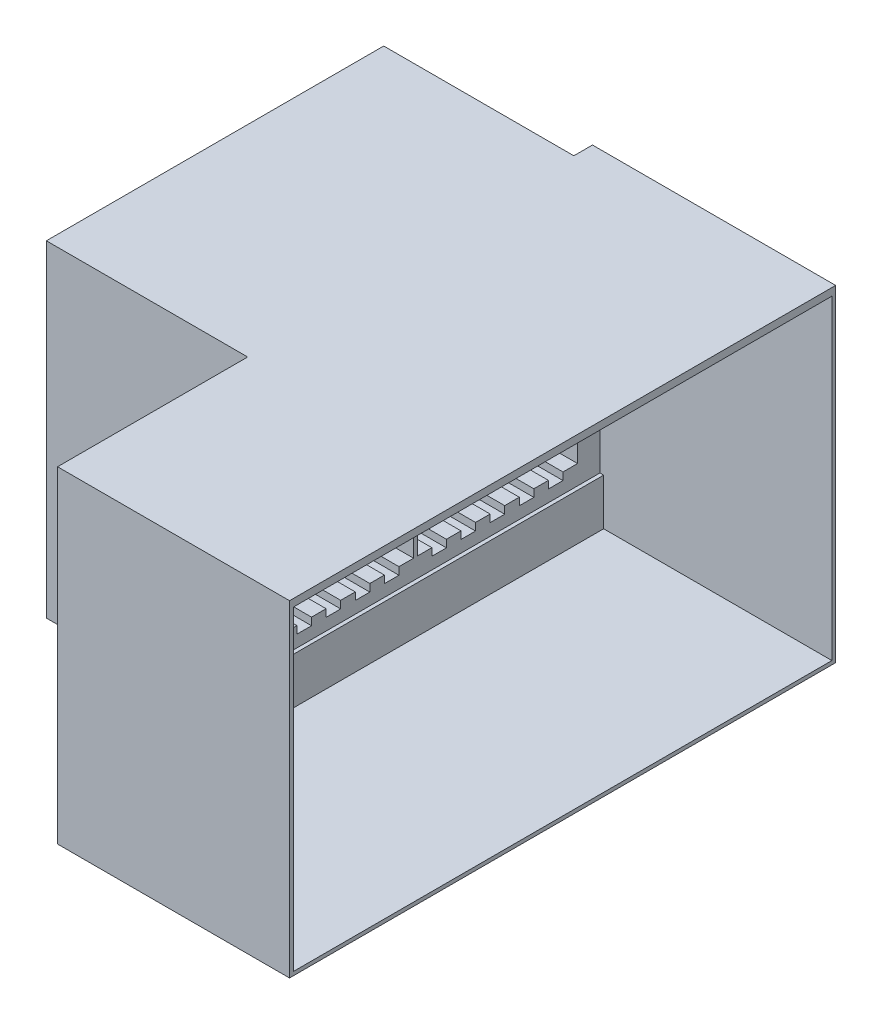
from build123d import *

# Parameters (mm, degrees)
SKETCH_3380_W                        = 955
SKETCH_3380_H                        = 876.56
EXTRUDE_3558_DEPTH                   = 1162.3
SKETCH_3599_W                        = 945
SKETCH_3599_H                        = 721.96
CUT_EXTRUDE_3658_DEPTH               = 622.3
SKETCH_3708_W                        = 430
SKETCH_3708_H                        = 320
CUT_EXTRUDE_3800_DEPTH               = 510
SKETCH_3851_W                        = 435
SKETCH_3851_H                        = 320
CUT_EXTRUDE_3944_DEPTH               = 10
SKETCH_3993_W                        = 602.3
SKETCH_3993_H                        = 945
CUT_EXTRUDE_4521_DEPTH               = 124.6
SKETCH_4570_W                        = 602.3
SKETCH_4570_H                        = 945
CUT_EXTRUDE_4710_DEPTH               = 10
SKETCH_4765_W                        = 39.090909091
SKETCH_4765_H                        = 20
CUT_EXTRUDE_4919_DEPTH               = 510
PATTERN_LINEAR_4973_COUNT            = 5
PATTERN_LINEAR_4973_PITCH            = 78.181818182
PATTERN_LINEAR_5041_COUNT            = 2
PATTERN_LINEAR_5041_PITCH            = 440
PATTERN_LINEAR_5041_COUNT_DIR2       = 2
PATTERN_LINEAR_5041_PITCH_DIR2       = 350
PATTERN_LINEAR_5041_COPY_1_SKETCH_W  = 39.090909091
PATTERN_LINEAR_5041_COPY_1_SKETCH_H  = 20
PATTERN_LINEAR_5041_COPY_1_DEPTH     = 510
PATTERN_LINEAR_5041_COPY_2_SKETCH_W  = 39.090909091
PATTERN_LINEAR_5041_COPY_2_SKETCH_H  = 20
PATTERN_LINEAR_5041_COPY_2_DEPTH     = 510
PATTERN_LINEAR_5041_COPY_3_SKETCH_W  = 39.090909091
PATTERN_LINEAR_5041_COPY_3_SKETCH_H  = 20
PATTERN_LINEAR_5041_COPY_3_DEPTH     = 510
PATTERN_LINEAR_5041_COPY_4_SKETCH_W  = 39.090909091
PATTERN_LINEAR_5041_COPY_4_SKETCH_H  = 20
PATTERN_LINEAR_5041_COPY_4_DEPTH     = 510
PATTERN_LINEAR_5041_COPY_5_SKETCH_W  = 39.090909091
PATTERN_LINEAR_5041_COPY_5_SKETCH_H  = 20
PATTERN_LINEAR_5041_COPY_5_DEPTH     = 510
PATTERN_LINEAR_5041_COPY_6_SKETCH_W  = 39.090909091
PATTERN_LINEAR_5041_COPY_6_SKETCH_H  = 20
PATTERN_LINEAR_5041_COPY_6_DEPTH     = 510
PATTERN_LINEAR_5041_COPY_7_SKETCH_W  = 39.090909091
PATTERN_LINEAR_5041_COPY_7_SKETCH_H  = 20
PATTERN_LINEAR_5041_COPY_7_DEPTH     = 510
PATTERN_LINEAR_5041_COPY_8_SKETCH_W  = 39.090909091
PATTERN_LINEAR_5041_COPY_8_SKETCH_H  = 20
PATTERN_LINEAR_5041_COPY_8_DEPTH     = 510
PATTERN_LINEAR_5041_COPY_9_SKETCH_W  = 39.090909091
PATTERN_LINEAR_5041_COPY_9_SKETCH_H  = 20
PATTERN_LINEAR_5041_COPY_9_DEPTH     = 510
PATTERN_LINEAR_5041_COPY_10_SKETCH_W = 39.090909091
PATTERN_LINEAR_5041_COPY_10_SKETCH_H = 20
PATTERN_LINEAR_5041_COPY_10_DEPTH    = 510
PATTERN_LINEAR_5041_COPY_11_SKETCH_W = 39.090909091
PATTERN_LINEAR_5041_COPY_11_SKETCH_H = 20
PATTERN_LINEAR_5041_COPY_11_DEPTH    = 510
PATTERN_LINEAR_5041_COPY_12_SKETCH_W = 39.090909091
PATTERN_LINEAR_5041_COPY_12_SKETCH_H = 20
PATTERN_LINEAR_5041_COPY_12_DEPTH    = 510
PATTERN_LINEAR_5041_COPY_13_SKETCH_W = 39.090909091
PATTERN_LINEAR_5041_COPY_13_SKETCH_H = 20
PATTERN_LINEAR_5041_COPY_13_DEPTH    = 510
PATTERN_LINEAR_5041_COPY_14_SKETCH_W = 39.090909091
PATTERN_LINEAR_5041_COPY_14_SKETCH_H = 20
PATTERN_LINEAR_5041_COPY_14_DEPTH    = 510
PATTERN_LINEAR_5041_COPY_15_SKETCH_W = 39.090909091
PATTERN_LINEAR_5041_COPY_15_SKETCH_H = 20
PATTERN_LINEAR_5041_COPY_15_DEPTH    = 510
EXTRUDE_5710_DEPTH                   = 500
SKETCH_5791_W                        = 622.3
SKETCH_5791_H                        = 876.56
EXTRUDE_5950_DEPTH                   = 10
SKETCH_14_W                          = 510
SKETCH_14_H                          = 876.56
CUT_EXTRUDE_1_DEPTH                  = 50
CUT_EXTRUDE_2_REACH                  = 1588.88
SKETCH_15_W                          = 1445
SKETCH_15_H                          = 124.6


with BuildPart() as part:
    # Sketch 3380 → Extrude 3558 (new body)
    with BuildSketch(Plane(origin=(0, 0, 0), x_dir=(0, 0, -1), z_dir=(1, 0, 0))):
        Rectangle(SKETCH_3380_W, SKETCH_3380_H)
    extrude(amount=EXTRUDE_3558_DEPTH)

    # Sketch 3599 → Cut-Extrude 3658 (cut)
    with BuildSketch(Plane(origin=(1162.3, 0, 0), x_dir=(0, 0, -1), z_dir=(1, 0, 0))):
        with Locations((-5, 57.3)):
            Rectangle(SKETCH_3599_W, SKETCH_3599_H)
    extrude(amount=-CUT_EXTRUDE_3658_DEPTH, mode=Mode.SUBTRACT)

    # Sketch 3708 → Cut-Extrude 3800 (cut)
    with BuildSketch(Plane(origin=(540, 0, 0), x_dir=(0, 0, -1), z_dir=(1, 0, 0))):
        with Locations((-247.5, 258.28)):
            Rectangle(SKETCH_3708_W, SKETCH_3708_H)
    cut_extrude_3800 = extrude(amount=-CUT_EXTRUDE_3800_DEPTH, mode=Mode.SUBTRACT)

    # Sketch 3851 → Cut-Extrude 3944 (cut)
    with BuildSketch(Plane.ZY):
        with Locations((250, 258.28)):
            Rectangle(SKETCH_3851_W, SKETCH_3851_H)
    cut_extrude_3944 = extrude(amount=-CUT_EXTRUDE_3944_DEPTH, mode=Mode.SUBTRACT)

    # Sketch 3993 → Cut-Extrude 4521 (cut)
    with BuildSketch(Plane(origin=(0, -303.68, 0), x_dir=(1, 0, 0), z_dir=(0, 1, 0))):
        with Locations((851.15, -5)):
            Rectangle(SKETCH_3993_W, SKETCH_3993_H)
    extrude(amount=-CUT_EXTRUDE_4521_DEPTH, mode=Mode.SUBTRACT)

    # Sketch 4570 → Cut-Extrude 4710 (cut)
    with BuildSketch(Plane.XZ.offset(-418.28)):
        with Locations((851.15, 5)):
            Rectangle(SKETCH_4570_W, SKETCH_4570_H)
    extrude(amount=-CUT_EXTRUDE_4710_DEPTH, mode=Mode.SUBTRACT)

    # Sketch 4765 → Cut-Extrude 4919 (cut)
    with BuildSketch(Plane(origin=(540, 0, 0), x_dir=(0, 0, -1), z_dir=(1, 0, 0))):
        with Locations((-403.863636364, 88.28)):
            Rectangle(SKETCH_4765_W, SKETCH_4765_H)
    cut_extrude_4919 = extrude(amount=-CUT_EXTRUDE_4919_DEPTH, mode=Mode.SUBTRACT)

    # Pattern Linear 4973: Cut-Extrude 4919 ×5
    with Locations(*[(0, 0, -i * PATTERN_LINEAR_4973_PITCH) for i in range(1, PATTERN_LINEAR_4973_COUNT)]):
        add(cut_extrude_4919, mode=Mode.SUBTRACT)

    # Pattern Linear 5041: Cut-Extrude 3800, Cut-Extrude 3944 2 × 2
    with Locations(*[(0, -j * PATTERN_LINEAR_5041_PITCH_DIR2, -i * PATTERN_LINEAR_5041_PITCH) for i in range(PATTERN_LINEAR_5041_COUNT) for j in range(PATTERN_LINEAR_5041_COUNT_DIR2) if (i, j) != (0, 0)]):
        add(cut_extrude_3800, mode=Mode.SUBTRACT)
        add(cut_extrude_3944, mode=Mode.SUBTRACT)

    # Pattern Linear 5041 copy 1 sketch → Pattern Linear 5041 copy 1 (cut)
    with BuildSketch(Plane(origin=(540, -350, -78.181818182), x_dir=(0, 0, -1), z_dir=(1, 0, 0))):
        with Locations((-403.863636364, 88.28)):
            Rectangle(PATTERN_LINEAR_5041_COPY_1_SKETCH_W, PATTERN_LINEAR_5041_COPY_1_SKETCH_H)
    extrude(amount=-PATTERN_LINEAR_5041_COPY_1_DEPTH, mode=Mode.SUBTRACT)

    # Pattern Linear 5041 copy 2 sketch → Pattern Linear 5041 copy 2 (cut)
    with BuildSketch(Plane(origin=(540, 0, -518.181818182), x_dir=(0, 0, -1), z_dir=(1, 0, 0))):
        with Locations((-403.863636364, 88.28)):
            Rectangle(PATTERN_LINEAR_5041_COPY_2_SKETCH_W, PATTERN_LINEAR_5041_COPY_2_SKETCH_H)
    extrude(amount=-PATTERN_LINEAR_5041_COPY_2_DEPTH, mode=Mode.SUBTRACT)

    # Pattern Linear 5041 copy 3 sketch → Pattern Linear 5041 copy 3 (cut)
    with BuildSketch(Plane(origin=(540, -350, -518.181818182), x_dir=(0, 0, -1), z_dir=(1, 0, 0))):
        with Locations((-403.863636364, 88.28)):
            Rectangle(PATTERN_LINEAR_5041_COPY_3_SKETCH_W, PATTERN_LINEAR_5041_COPY_3_SKETCH_H)
    extrude(amount=-PATTERN_LINEAR_5041_COPY_3_DEPTH, mode=Mode.SUBTRACT)

    # Pattern Linear 5041 copy 4 sketch → Pattern Linear 5041 copy 4 (cut)
    with BuildSketch(Plane(origin=(540, -350, -156.363636364), x_dir=(0, 0, -1), z_dir=(1, 0, 0))):
        with Locations((-403.863636364, 88.28)):
            Rectangle(PATTERN_LINEAR_5041_COPY_4_SKETCH_W, PATTERN_LINEAR_5041_COPY_4_SKETCH_H)
    extrude(amount=-PATTERN_LINEAR_5041_COPY_4_DEPTH, mode=Mode.SUBTRACT)

    # Pattern Linear 5041 copy 5 sketch → Pattern Linear 5041 copy 5 (cut)
    with BuildSketch(Plane(origin=(540, 0, -596.363636364), x_dir=(0, 0, -1), z_dir=(1, 0, 0))):
        with Locations((-403.863636364, 88.28)):
            Rectangle(PATTERN_LINEAR_5041_COPY_5_SKETCH_W, PATTERN_LINEAR_5041_COPY_5_SKETCH_H)
    extrude(amount=-PATTERN_LINEAR_5041_COPY_5_DEPTH, mode=Mode.SUBTRACT)

    # Pattern Linear 5041 copy 6 sketch → Pattern Linear 5041 copy 6 (cut)
    with BuildSketch(Plane(origin=(540, -350, -596.363636364), x_dir=(0, 0, -1), z_dir=(1, 0, 0))):
        with Locations((-403.863636364, 88.28)):
            Rectangle(PATTERN_LINEAR_5041_COPY_6_SKETCH_W, PATTERN_LINEAR_5041_COPY_6_SKETCH_H)
    extrude(amount=-PATTERN_LINEAR_5041_COPY_6_DEPTH, mode=Mode.SUBTRACT)

    # Pattern Linear 5041 copy 7 sketch → Pattern Linear 5041 copy 7 (cut)
    with BuildSketch(Plane(origin=(540, -350, -234.545454545), x_dir=(0, 0, -1), z_dir=(1, 0, 0))):
        with Locations((-403.863636364, 88.28)):
            Rectangle(PATTERN_LINEAR_5041_COPY_7_SKETCH_W, PATTERN_LINEAR_5041_COPY_7_SKETCH_H)
    extrude(amount=-PATTERN_LINEAR_5041_COPY_7_DEPTH, mode=Mode.SUBTRACT)

    # Pattern Linear 5041 copy 8 sketch → Pattern Linear 5041 copy 8 (cut)
    with BuildSketch(Plane(origin=(540, 0, -674.545454545), x_dir=(0, 0, -1), z_dir=(1, 0, 0))):
        with Locations((-403.863636364, 88.28)):
            Rectangle(PATTERN_LINEAR_5041_COPY_8_SKETCH_W, PATTERN_LINEAR_5041_COPY_8_SKETCH_H)
    extrude(amount=-PATTERN_LINEAR_5041_COPY_8_DEPTH, mode=Mode.SUBTRACT)

    # Pattern Linear 5041 copy 9 sketch → Pattern Linear 5041 copy 9 (cut)
    with BuildSketch(Plane(origin=(540, -350, -674.545454545), x_dir=(0, 0, -1), z_dir=(1, 0, 0))):
        with Locations((-403.863636364, 88.28)):
            Rectangle(PATTERN_LINEAR_5041_COPY_9_SKETCH_W, PATTERN_LINEAR_5041_COPY_9_SKETCH_H)
    extrude(amount=-PATTERN_LINEAR_5041_COPY_9_DEPTH, mode=Mode.SUBTRACT)

    # Pattern Linear 5041 copy 10 sketch → Pattern Linear 5041 copy 10 (cut)
    with BuildSketch(Plane(origin=(540, -350, -312.727272727), x_dir=(0, 0, -1), z_dir=(1, 0, 0))):
        with Locations((-403.863636364, 88.28)):
            Rectangle(PATTERN_LINEAR_5041_COPY_10_SKETCH_W, PATTERN_LINEAR_5041_COPY_10_SKETCH_H)
    extrude(amount=-PATTERN_LINEAR_5041_COPY_10_DEPTH, mode=Mode.SUBTRACT)

    # Pattern Linear 5041 copy 11 sketch → Pattern Linear 5041 copy 11 (cut)
    with BuildSketch(Plane(origin=(540, 0, -752.727272727), x_dir=(0, 0, -1), z_dir=(1, 0, 0))):
        with Locations((-403.863636364, 88.28)):
            Rectangle(PATTERN_LINEAR_5041_COPY_11_SKETCH_W, PATTERN_LINEAR_5041_COPY_11_SKETCH_H)
    extrude(amount=-PATTERN_LINEAR_5041_COPY_11_DEPTH, mode=Mode.SUBTRACT)

    # Pattern Linear 5041 copy 12 sketch → Pattern Linear 5041 copy 12 (cut)
    with BuildSketch(Plane(origin=(540, -350, -752.727272727), x_dir=(0, 0, -1), z_dir=(1, 0, 0))):
        with Locations((-403.863636364, 88.28)):
            Rectangle(PATTERN_LINEAR_5041_COPY_12_SKETCH_W, PATTERN_LINEAR_5041_COPY_12_SKETCH_H)
    extrude(amount=-PATTERN_LINEAR_5041_COPY_12_DEPTH, mode=Mode.SUBTRACT)

    # Pattern Linear 5041 copy 13 sketch → Pattern Linear 5041 copy 13 (cut)
    with BuildSketch(Plane(origin=(540, -350, 0), x_dir=(0, 0, -1), z_dir=(1, 0, 0))):
        with Locations((-403.863636364, 88.28)):
            Rectangle(PATTERN_LINEAR_5041_COPY_13_SKETCH_W, PATTERN_LINEAR_5041_COPY_13_SKETCH_H)
    extrude(amount=-PATTERN_LINEAR_5041_COPY_13_DEPTH, mode=Mode.SUBTRACT)

    # Pattern Linear 5041 copy 14 sketch → Pattern Linear 5041 copy 14 (cut)
    with BuildSketch(Plane(origin=(540, 0, -440), x_dir=(0, 0, -1), z_dir=(1, 0, 0))):
        with Locations((-403.863636364, 88.28)):
            Rectangle(PATTERN_LINEAR_5041_COPY_14_SKETCH_W, PATTERN_LINEAR_5041_COPY_14_SKETCH_H)
    extrude(amount=-PATTERN_LINEAR_5041_COPY_14_DEPTH, mode=Mode.SUBTRACT)

    # Pattern Linear 5041 copy 15 sketch → Pattern Linear 5041 copy 15 (cut)
    with BuildSketch(Plane(origin=(540, -350, -440), x_dir=(0, 0, -1), z_dir=(1, 0, 0))):
        with Locations((-403.863636364, 88.28)):
            Rectangle(PATTERN_LINEAR_5041_COPY_15_SKETCH_W, PATTERN_LINEAR_5041_COPY_15_SKETCH_H)
    extrude(amount=-PATTERN_LINEAR_5041_COPY_15_DEPTH, mode=Mode.SUBTRACT)

    # Sketch 5113 → Extrude 5710 (add)
    with BuildSketch(Plane.XY.offset(477.5)):
        Polygon((1162.3, -438.28), (1162.3, -303.68), (1152.3, -303.68), (1152.3, -428.28), (550, -428.28), (550, -303.68), (540, -303.68), (540, -438.28), align=None)
        Polygon((1152.3, 418.28), (1162.3, 418.28), (1162.3, 438.28), (540, 438.28), (540, 418.28), (550, 418.28), (550, 428.28), (1152.3, 428.28), align=None)
    extrude(amount=EXTRUDE_5710_DEPTH)

    # Sketch 5791 → Extrude 5950 (add)
    with BuildSketch(Plane.XY.offset(977.5)):
        with Locations((851.15, 0)):
            Rectangle(SKETCH_5791_W, SKETCH_5791_H)
    extrude(amount=EXTRUDE_5950_DEPTH)

    # Эскиз14 → Вырез-Вытянуть1 (cut)
    with BuildSketch(Plane(origin=(0, 0, -477.5), x_dir=(-1, 0, 0), z_dir=(0, 0, -1))):
        with Locations((-255, 0)):
            Rectangle(SKETCH_14_W, SKETCH_14_H)
    extrude(amount=-CUT_EXTRUDE_1_DEPTH, mode=Mode.SUBTRACT)

    # Эскиз15 → Вырез-Вытянуть2 (cut, up to next)
    with BuildSketch(Plane(origin=(1162.3, 0, 0), x_dir=(0, 0, -1), z_dir=(1, 0, 0)), mode=Mode.PRIVATE) as cut_extrude_2_sk1:
        with Locations((-255, -365.98)):
            Rectangle(SKETCH_15_W, SKETCH_15_H)
    cut_extrude_2_tool1 = extrude(cut_extrude_2_sk1.sketch, amount=-CUT_EXTRUDE_2_REACH, mode=Mode.PRIVATE) & part.part
    add(cut_extrude_2_tool1.solids().sort_by_distance((1162.3, -365.98, 255))[0], mode=Mode.SUBTRACT)


solid = part.part
